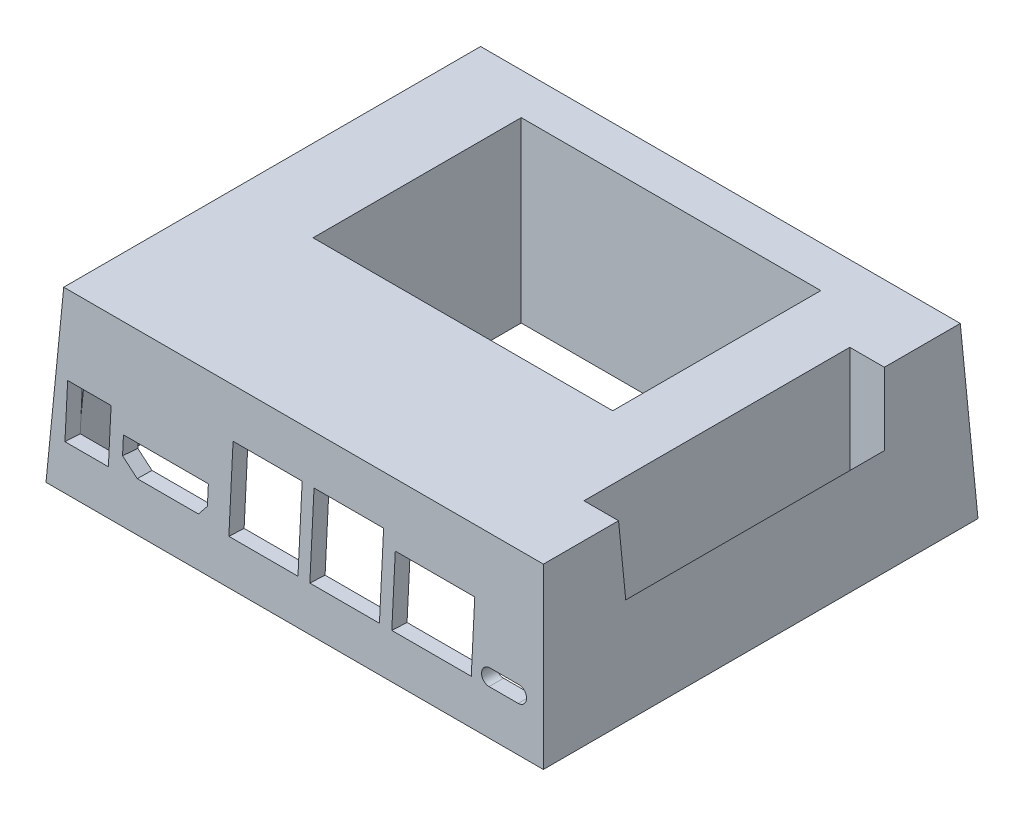
from build123d import *

# Parameters (mm, degrees)
SKETCH2_W                                         = 103
SKETCH2_H                                         = 90
SKETCH2_W_2                                       = 4.981131341
SKETCH2_H_2                                       = 51.379447355
SKETCH2_W_3                                       = 58.371562284
SKETCH2_H_3                                       = 39.434223375
BOSS_EXTRUDE2_DEPTH                               = 35
BOSS_EXTRUDE2_TAPER                               = 3
SHELL2_OUTLINE_W                                  = 67.733894234
SHELL2_OUTLINE_H                                  = 48.796555325
SHELL2_DEPTH                                      = 32
SHELL2_DRAFT                                      = 3
SKETCH11_W                                        = 8.997468353
SKETCH11_H                                        = 10.72090286
CUT_EXTRUDE2_DEPTH                                = 3
CUT_EXTRUDE2_DRAFT                                = -3
SKETCH11_W_2                                      = 14.518642115
SKETCH11_H_2                                      = 16.642925392
CUT_EXTRUDE2_PROFILE_2_DEPTH                      = 3
CUT_EXTRUDE2_PROFILE_2_DRAFT                      = -3
SKETCH11_W_3                                      = 14.620886073
CUT_EXTRUDE2_PROFILE_3_DEPTH                      = 3
CUT_EXTRUDE2_PROFILE_3_DRAFT                      = -3
SKETCH11_W_4                                      = 16.665765244
SKETCH11_H_3                                      = 13.8861218
CUT_EXTRUDE2_PROFILE_4_DEPTH                      = 3
CUT_EXTRUDE2_PROFILE_4_DRAFT                      = -3
CUT_EXTRUDE2_PROFILE_5_DEPTH                      = 3
CUT_EXTRUDE2_PROFILE_5_DRAFT                      = -3
CUT_EXTRUDE2_PROFILE_6_DEPTH                      = 3
CUT_EXTRUDE2_PROFILE_6_DRAFT                      = -3
CSK_FOR_0_FLAT_HEAD_MACHINE_SCREW_100_D           = 1.778
CSK_FOR_0_FLAT_HEAD_MACHINE_SCREW_100_CSINK_D     = 3.0226
CSK_FOR_0_FLAT_HEAD_MACHINE_SCREW_100_CSINK_ANGLE = 100
CSK_FOR_0_FLAT_HEAD_MACHINE_SCREW_2_D             = 1.778
CSK_FOR_0_FLAT_HEAD_MACHINE_SCREW_2_CSINK_D       = 3.0226
CSK_FOR_0_FLAT_HEAD_MACHINE_SCREW_2_CSINK_ANGLE   = 100
DRAFT4_START                                      = 5
DRAFT4_DEPTH                                      = 19


with BuildPart() as part:
    # Sketch2 → Boss-Extrude2 (new body)
    with BuildSketch(Plane(origin=(0, 0, 0), x_dir=(1, 0, 0), z_dir=(0, 1, 0))):
        with Locations((51.5, 0)):
            Rectangle(SKETCH2_W, SKETCH2_H)
        with Locations((98.329809834, -0.07834477)):
            Rectangle(SKETCH2_W_2, SKETCH2_H_2, mode=Mode.SUBTRACT)
        with Locations((49.815754183, 13.061230018)):
            Rectangle(SKETCH2_W_3, SKETCH2_H_3, mode=Mode.SUBTRACT)
    extrude(amount=BOSS_EXTRUDE2_DEPTH, taper=BOSS_EXTRUDE2_TAPER)


with BuildPart() as shell2_tool:
    # Shell2: read off the stored shape, not the designer's step
    # Shell2 outline → Shell2 (with draft: the straight prism first)
    with BuildSketch(Plane(origin=(0, 32, 0), x_dir=(1, 0, 0), z_dir=(0, 1, 0))):
        Polygon((98.318834025, -30.449234423), (91.158078188, -30.449234423), (91.158078188, 30.292544882), (98.318834025, 30.292544882), (98.318834025, 40.318834025), (4.681165975, 40.318834025), (4.681165975, -40.318834025), (98.318834025, -40.318834025), align=None)
        with Locations((49.815754183, 13.061230019)):
            Rectangle(SHELL2_OUTLINE_W, SHELL2_OUTLINE_H, mode=Mode.SUBTRACT)
    extrude(amount=-SHELL2_DEPTH)
    # Shell2: the draft: its side faces are tilted about the plane it starts from
    shell2_sides = [shell2_tool.faces().sort_by_distance(p)[0] for p in [
        (94.738456106, 16, 30.449234423),
        (91.158078188, 16, 0.07834477),
        (94.738456107, 16, -30.292544882),
        (98.318834025, 16, -35.305689454),
        (51.5, 16, -40.318834025),
        (4.681165975, 16, 0),
        (51.5, 16, 40.318834025),
        (98.318834025, 16, 35.384034224),
        (15.948807066, 16, -13.061230018),
        (49.815754183, 16, -37.459507681),
        (83.6827013, 16, -13.061230018),
        (49.815754183, 16, 11.337047644),
    ]]
    draft(shell2_sides, Plane(origin=(0, 32, 0), x_dir=(1, 0, 0), z_dir=(0, 1, 0)), SHELL2_DRAFT)


with BuildPart() as part_1:
    add(part.part)

    # Shell2: cut by shell2_tool
    add(shell2_tool.part, mode=Mode.SUBTRACT)


with BuildPart() as cut_extrude2_tool:
    # Sketch11 → Cut-Extrude2 (with draft: the straight prism first)
    with BuildSketch(Plane(origin=(0, 2.351890424, 44.876742646), x_dir=(1, 0, 0), z_dir=(0, 0.0523359562429439, 0.998629534754574))):
        with Locations((7.959003718, 11.806398056)):
            Rectangle(SKETCH11_W, SKETCH11_H)
    extrude(amount=-CUT_EXTRUDE2_DEPTH)
    # Cut-Extrude2: the draft: its side faces are tilted about the plane it starts from
    cut_extrude2_sides = [cut_extrude2_tool.faces().sort_by_distance(p)[0] for p in [
        (3.460269541, 14.063604287, 42.760899212),
        (7.959003718, 8.710499169, 43.041443563),
        (12.457737894, 14.063604287, 42.760899212),
        (7.959003718, 19.416709405, 42.48035486),
    ]]
    draft(cut_extrude2_sides, Plane(origin=(0, 2.351890424, 44.876742646), x_dir=(1, 0, 0), z_dir=(0, 0.0523359562429439, 0.998629534754574)), CUT_EXTRUDE2_DRAFT)


with BuildPart() as part_2:
    add(part_1.part)

    # Cut-Extrude2: cut by cut_extrude2_tool
    add(cut_extrude2_tool.part, mode=Mode.SUBTRACT)


with BuildPart() as cut_extrude2_profile_2_tool:
    # Sketch11 → Cut-Extrude2 profile 2 (with draft: the straight prism first)
    with BuildSketch(Plane(origin=(0, 2.351890424, 44.876742646), x_dir=(1, 0, 0), z_dir=(0, 0.0523359562429439, 0.998629534754574))):
        with Locations((44.664584839, 14.767409322)):
            Rectangle(SKETCH11_W_2, SKETCH11_H_2)
    extrude(amount=-CUT_EXTRUDE2_PROFILE_2_DEPTH)
    # Cut-Extrude2 profile 2: the draft: its side faces are tilted about the plane it starts from
    cut_extrude2_profile_2_sides = [cut_extrude2_profile_2_tool.faces().sort_by_distance(p)[0] for p in [
        (37.405263781, 17.02055759, 42.605931856),
        (44.664584839, 8.710499169, 43.041443563),
        (51.923905896, 17.02055759, 42.605931856),
        (44.664584839, 25.330616011, 42.170420148),
    ]]
    draft(cut_extrude2_profile_2_sides, Plane(origin=(0, 2.351890424, 44.876742646), x_dir=(1, 0, 0), z_dir=(0, 0.0523359562429439, 0.998629534754574)), CUT_EXTRUDE2_PROFILE_2_DRAFT)


with BuildPart() as part_3:
    add(part_2.part)

    # Cut-Extrude2 profile 2: cut by cut_extrude2_profile_2_tool
    add(cut_extrude2_profile_2_tool.part, mode=Mode.SUBTRACT)


with BuildPart() as cut_extrude2_profile_3_tool:
    # Sketch11 → Cut-Extrude2 profile 3 (with draft: the straight prism first)
    with BuildSketch(Plane(origin=(0, 2.351890424, 44.876742646), x_dir=(1, 0, 0), z_dir=(0, 0.0523359562429439, 0.998629534754574))):
        with Locations((61.48371602, 14.767409322)):
            Rectangle(SKETCH11_W_3, SKETCH11_H_2)
    extrude(amount=-CUT_EXTRUDE2_PROFILE_3_DEPTH)
    # Cut-Extrude2 profile 3: the draft: its side faces are tilted about the plane it starts from
    cut_extrude2_profile_3_sides = [cut_extrude2_profile_3_tool.faces().sort_by_distance(p)[0] for p in [
        (54.173272984, 17.02055759, 42.605931856),
        (61.483716021, 8.710499169, 43.041443563),
        (68.794159057, 17.02055759, 42.605931856),
        (61.483716021, 25.330616011, 42.170420148),
    ]]
    draft(cut_extrude2_profile_3_sides, Plane(origin=(0, 2.351890424, 44.876742646), x_dir=(1, 0, 0), z_dir=(0, 0.0523359562429439, 0.998629534754574)), CUT_EXTRUDE2_PROFILE_3_DRAFT)


with BuildPart() as part_4:
    add(part_3.part)

    # Cut-Extrude2 profile 3: cut by cut_extrude2_profile_3_tool
    add(cut_extrude2_profile_3_tool.part, mode=Mode.SUBTRACT)


with BuildPart() as cut_extrude2_profile_4_tool:
    # Sketch11 → Cut-Extrude2 profile 4 (with draft: the straight prism first)
    with BuildSketch(Plane(origin=(0, 2.351890424, 44.876742646), x_dir=(1, 0, 0), z_dir=(0, 0.0523359562429439, 0.998629534754574))):
        with Locations((79.478652726, 13.389007526)):
            Rectangle(SKETCH11_W_4, SKETCH11_H_3)
    extrude(amount=-CUT_EXTRUDE2_PROFILE_4_DEPTH)
    # Cut-Extrude2 profile 4: the draft: its side faces are tilted about the plane it starts from
    cut_extrude2_profile_4_sides = [cut_extrude2_profile_4_tool.faces().sort_by_distance(p)[0] for p in [
        (71.145770104, 15.644044846, 42.678071832),
        (79.478652726, 8.710499169, 43.041443563),
        (87.811535348, 15.644044846, 42.678071832),
        (79.478652726, 22.577590522, 42.3147001),
    ]]
    draft(cut_extrude2_profile_4_sides, Plane(origin=(0, 2.351890424, 44.876742646), x_dir=(1, 0, 0), z_dir=(0, 0.0523359562429439, 0.998629534754574)), CUT_EXTRUDE2_PROFILE_4_DRAFT)


with BuildPart() as part_5:
    add(part_4.part)

    # Cut-Extrude2 profile 4: cut by cut_extrude2_profile_4_tool
    add(cut_extrude2_profile_4_tool.part, mode=Mode.SUBTRACT)


with BuildPart() as cut_extrude2_profile_5_tool:
    # Sketch11 → Cut-Extrude2 profile 5 (with draft: the straight prism first)
    with BuildSketch(Plane(origin=(0, 2.351890424, 44.876742646), x_dir=(1, 0, 0), z_dir=(0, 0.0523359562429439, 0.998629534754574))):
        Polygon((18.38788749, 7.26277732), (31.066138351, 7.26277732), (33.008773563, 9.713269403), (33.008773563, 13.389007526), (15.218324775, 13.389007526), (15.218324775, 9.713269403), align=None)
    extrude(amount=-CUT_EXTRUDE2_PROFILE_5_DEPTH)
    # Cut-Extrude2 profile 5: the draft: its side faces are tilted about the plane it starts from
    cut_extrude2_profile_5_sides = [cut_extrude2_profile_5_tool.faces().sort_by_distance(p)[0] for p in [
        (24.727012921, 9.526210425, 42.998693948),
        (32.037455957, 10.74977731, 42.934569524),
        (33.008773563, 13.80869452, 42.774258466),
        (24.113549169, 15.644044846, 42.678071832),
        (15.218324775, 13.80869452, 42.774258466),
        (16.803106133, 10.74977731, 42.934569524),
    ]]
    draft(cut_extrude2_profile_5_sides, Plane(origin=(0, 2.351890424, 44.876742646), x_dir=(1, 0, 0), z_dir=(0, 0.0523359562429439, 0.998629534754574)), CUT_EXTRUDE2_PROFILE_5_DRAFT)


with BuildPart() as part_6:
    add(part_5.part)

    # Cut-Extrude2 profile 5: cut by cut_extrude2_profile_5_tool
    add(cut_extrude2_profile_5_tool.part, mode=Mode.SUBTRACT)


with BuildPart() as cut_extrude2_profile_6_tool:
    # Sketch11 → Cut-Extrude2 profile 6 (with draft: the straight prism first)
    with BuildSketch(Plane(origin=(0, 2.351890424, 44.876742646), x_dir=(1, 0, 0), z_dir=(0, 0.0523359562429439, 0.998629534754574))):
        with BuildLine():
            ThreePointArc((91.287829939, 9.713269403), (89.654168551, 8.079608014), (91.287829939, 6.445946626))
            Line((91.287829939, 6.445946626), (97.320223494, 6.445946626))
            ThreePointArc((97.320223494, 6.445946626), (98.953884882, 8.079608014), (97.320223494, 9.713269403))
            Line((97.320223494, 9.713269403), (91.287829939, 9.713269403))
        make_face()
    extrude(amount=-CUT_EXTRUDE2_PROFILE_6_DEPTH)
    # Cut-Extrude2 profile 6: the draft: its side faces are tilted about the plane it starts from
    cut_extrude2_profile_6_sides = [cut_extrude2_profile_6_tool.faces().sort_by_distance(p)[0] for p in [
        (94.304026716, 11.973344194, 42.870445101),
        (89.654168551, 10.341921681, 42.955944332),
        (94.304026716, 8.710499169, 43.041443563),
        (98.953884882, 10.341921681, 42.955944332),
    ]]
    draft(cut_extrude2_profile_6_sides, Plane(origin=(0, 2.351890424, 44.876742646), x_dir=(1, 0, 0), z_dir=(0, 0.0523359562429439, 0.998629534754574)), CUT_EXTRUDE2_PROFILE_6_DRAFT)


with BuildPart() as part_7:
    add(part_6.part)

    # Cut-Extrude2 profile 6: cut by cut_extrude2_profile_6_tool
    add(cut_extrude2_profile_6_tool.part, mode=Mode.SUBTRACT)

    # CSK for _0 Flat Head Machine Screw _100 (through all)
    with Locations(Plane(origin=(0.188541787, 3.597591615, -41), x_dir=(-0.052335956243, -0.998629534755, 0), z_dir=(-0.998629534755, 0.052335956243, 0))):
        with Locations((0, 0), (0.002528755, 82)):
            CounterSinkHole(CSK_FOR_0_FLAT_HEAD_MACHINE_SCREW_100_D / 2, CSK_FOR_0_FLAT_HEAD_MACHINE_SCREW_100_CSINK_D / 2, counter_sink_angle=CSK_FOR_0_FLAT_HEAD_MACHINE_SCREW_100_CSINK_ANGLE)

    # CSK for _0 Flat Head Machine Screw _ 2 (through all)
    with Locations(Plane(origin=(0.188541787, 3.597591615, -41), x_dir=(-0.052335956243, -0.998629534755, 0), z_dir=(-0.998629534755, 0.052335956243, 0))):
        with Locations((0, 0), (0.002528755, 82)):
            CounterSinkHole(CSK_FOR_0_FLAT_HEAD_MACHINE_SCREW_2_D / 2, CSK_FOR_0_FLAT_HEAD_MACHINE_SCREW_2_CSINK_D / 2, counter_sink_angle=CSK_FOR_0_FLAT_HEAD_MACHINE_SCREW_2_CSINK_ANGLE)

    # Draft4: read off the stored shape, not the designer's step
    # Draft4 outline → Draft4 (add)
    with BuildSketch(Plane(origin=(0, 0, 0), x_dir=(1, 0, 0), z_dir=(0, 0.9986295347545739, -0.052335956242943814)).offset(DRAFT4_START)):
        Polygon((51.923905896, -44.938329064), (51.766682558, -41.938329064), (51.714317363, -44.938329064), align=None)
        Polygon((87.65431201, -41.938329064), (87.601946816, -44.938329064), (87.811535348, -44.938329064), align=None)
        Polygon((68.636935719, -41.938329064), (68.584570525, -44.938329064), (68.794159057, -44.938329064), align=None)
        Polygon((32.799185031, -44.938329064), (33.008773563, -44.938329064), (32.851550226, -41.938329064), align=None)
    extrude(amount=DRAFT4_DEPTH)


solid = part_7.part
